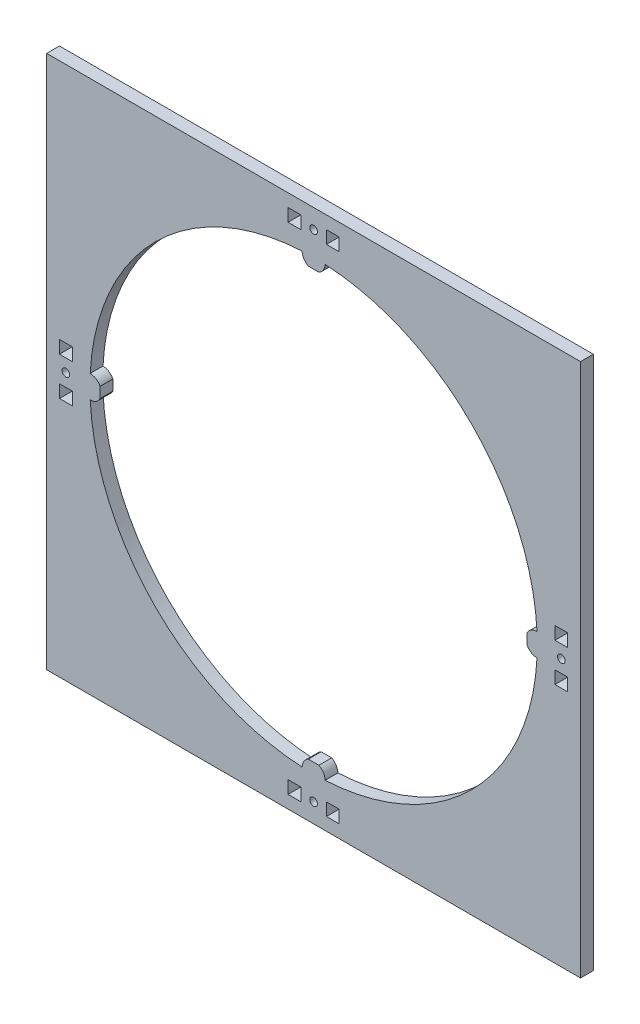
from build123d import *

# Parameters (mm, degrees)
BOSS_EXTRU_1_DEPTH = 5
BOSS_EXTRU_2_START = -5
ESQUISSE2_W        = 208.80895352
ESQUISSE2_H        = 208.80895352
ESQUISSE2_R        = 87.5
ESQUISSE2_R_2      = 1.5
ESQUISSE2_W_2      = 5
ESQUISSE2_H_2      = 5
BOSS_EXTRU_2_DEPTH = 5


# Read off the part's stored shape, not the designer's step: Boss.-Extru.1
with BuildPart() as part:
    # Boss.-Extru.1 outline → Boss.-Extru.1 (new body)
    with BuildSketch(Plane.XY):
        with BuildLine():
            Line((-15, 94.40447676), (-15, 99.40447676))
            Line((-15, 99.40447676), (-25, 99.40447676))
            ThreePointArc((-25, 99.40447676), (-72.478445072, 72.478445072), (-99.40447676, 25))
            Line((-99.40447676, 25), (-99.40447676, 15))
            Line((-99.40447676, 15), (-94.40447676, 15))
            Line((-94.40447676, 15), (-94.40447676, -15))
            Line((-94.40447676, -15), (-99.40447676, -15))
            Line((-99.40447676, -15), (-99.40447676, -25))
            ThreePointArc((-99.40447676, -25), (-72.478445072, -72.478445072), (-25, -99.40447676))
            Line((-25, -99.40447676), (-15, -99.40447676))
            Line((-15, -99.40447676), (-15, -94.40447676))
            Line((-15, -94.40447676), (15, -94.40447676))
            Line((15, -94.40447676), (15, -99.40447676))
            Line((15, -99.40447676), (25, -99.40447676))
            ThreePointArc((25, -99.40447676), (72.478445072, -72.478445072), (99.40447676, -25))
            Line((99.40447676, -25), (99.40447676, -15))
            Line((99.40447676, -15), (94.40447676, -15))
            Line((94.40447676, -15), (94.40447676, 15))
            Line((94.40447676, 15), (99.40447676, 15))
            Line((99.40447676, 15), (99.40447676, 25))
            ThreePointArc((99.40447676, 25), (72.478445072, 72.478445072), (25, 99.40447676))
            Line((25, 99.40447676), (15, 99.40447676))
            Line((15, 99.40447676), (15, 94.40447676))
            Line((15, 94.40447676), (-15, 94.40447676))
        make_face()
        with BuildLine():
            ThreePointArc((-2.061552813, -83.5), (-3.811893422, -85.108458961), (-4.498511999, -87.384285714))
            ThreePointArc((-4.498511999, -87.384285714), (-61.871843354, -61.871843354), (-87.384285714, -4.498511999))
            ThreePointArc((-87.384285714, -4.498511999), (-85.108458961, -3.811893422), (-83.5, -2.061552813))
            Line((-83.5, -2.061552813), (-83.5, 2.061552813))
            ThreePointArc((-83.5, 2.061552813), (-85.108458961, 3.811893422), (-87.384285714, 4.498511999))
            ThreePointArc((-87.384285714, 4.498511999), (-61.871843354, 61.871843354), (-4.498511999, 87.384285714))
            ThreePointArc((-4.498511999, 87.384285714), (-3.811893422, 85.108458961), (-2.061552813, 83.5))
            Line((-2.061552813, 83.5), (2.061552813, 83.5))
            ThreePointArc((2.061552813, 83.5), (3.811893422, 85.108458961), (4.498511999, 87.384285714))
            ThreePointArc((4.498511999, 87.384285714), (61.871843354, 61.871843354), (87.384285714, 4.498511999))
            ThreePointArc((87.384285714, 4.498511999), (85.108458961, 3.811893422), (83.5, 2.061552813))
            Line((83.5, 2.061552813), (83.5, -2.061552813))
            ThreePointArc((83.5, -2.061552813), (85.108458961, -3.811893422), (87.384285714, -4.498511999))
            ThreePointArc((87.384285714, -4.498511999), (61.871843354, -61.871843354), (4.498511999, -87.384285714))
            ThreePointArc((4.498511999, -87.384285714), (3.811893422, -85.108458961), (2.061552813, -83.5))
            Line((2.061552813, -83.5), (-2.061552813, -83.5))
        make_face(mode=Mode.SUBTRACT)
    extrude(amount=BOSS_EXTRU_1_DEPTH)

    # Esquisse2 → Boss.-Extru.2 (add)
    with BuildSketch(Plane.XY.offset(5).offset(BOSS_EXTRU_2_START)):
        Rectangle(ESQUISSE2_W, ESQUISSE2_H)
        Circle(ESQUISSE2_R, mode=Mode.SUBTRACT)
        with Locations((0, 96.90447676)):
            Circle(ESQUISSE2_R_2, mode=Mode.SUBTRACT)
        with Locations((96.90447676, 0)):
            Circle(ESQUISSE2_R_2, mode=Mode.SUBTRACT)
        with Locations((0, -96.90447676)):
            Circle(ESQUISSE2_R_2, mode=Mode.SUBTRACT)
        with Locations((-96.90447676, 0)):
            Circle(ESQUISSE2_R_2, mode=Mode.SUBTRACT)
        with Locations((-7.5, 96.90447676)):
            Rectangle(ESQUISSE2_W_2, ESQUISSE2_H_2, mode=Mode.SUBTRACT)
        with Locations((7.5, 96.90447676)):
            Rectangle(ESQUISSE2_W_2, ESQUISSE2_H_2, mode=Mode.SUBTRACT)
        with Locations((96.90447676, 7.5)):
            Rectangle(ESQUISSE2_W_2, ESQUISSE2_H_2, mode=Mode.SUBTRACT)
        with Locations((96.90447676, -7.5)):
            Rectangle(ESQUISSE2_W_2, ESQUISSE2_H_2, mode=Mode.SUBTRACT)
        with Locations((7.5, -96.90447676)):
            Rectangle(ESQUISSE2_W_2, ESQUISSE2_H_2, mode=Mode.SUBTRACT)
        with Locations((-7.5, -96.90447676)):
            Rectangle(ESQUISSE2_W_2, ESQUISSE2_H_2, mode=Mode.SUBTRACT)
        with Locations((-96.90447676, -7.5)):
            Rectangle(ESQUISSE2_W_2, ESQUISSE2_H_2, mode=Mode.SUBTRACT)
        with Locations((-96.90447676, 7.5)):
            Rectangle(ESQUISSE2_W_2, ESQUISSE2_H_2, mode=Mode.SUBTRACT)
    extrude(amount=BOSS_EXTRU_2_DEPTH)


solid = part.part
